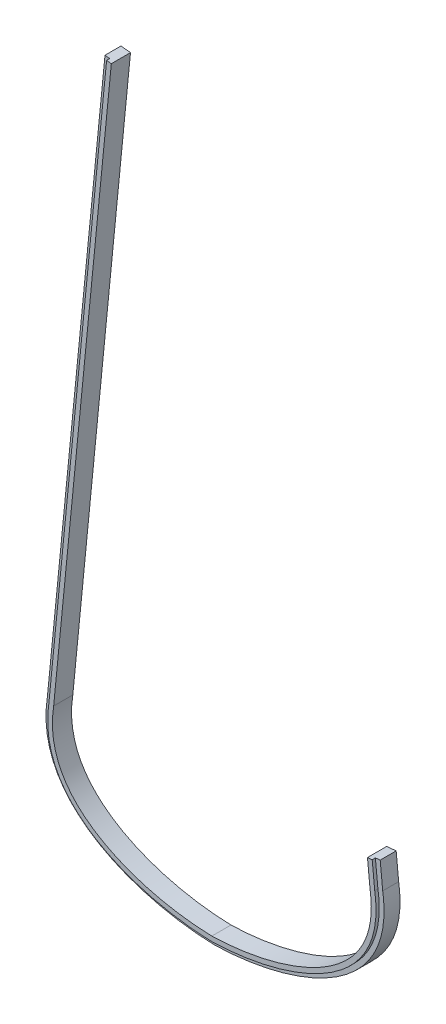
from build123d import *

# Parameters (mm, degrees)
BOSS_EXTRUDE1_DEPTH = 19.05
CUT_EXTRUDE1_START  = -3.175
CUT_EXTRUDE1_DEPTH  = 3.175


# Read off the part's stored shape, not the designer's step: Cut-Extrude1
with BuildPart() as part:
    # Sketch1 → Boss-Extrude1 (new body)
    with BuildSketch(Plane.XY):
        with BuildLine():
            Line((157.234081882, 128.980548454), (154.716315658, 154.51789158))
            Line((154.716315658, 154.51789158), (164.195357535, 155.452445004))
            Line((164.195357535, 155.452445004), (166.6875, 130.175))
            add(Edge.make_bspline(
                [(0, 0), (73.666580622, 1.740675992), (181.188092361, 36.200835609), (166.6875, 130.175)],
                knots=[0, 0, 0, 0, 1, 1, 1, 1], degree=3))
            add(Edge.make_bspline(
                [(0, 0), (-73.666580622, 1.740675992), (-181.188092361, 36.200835609), (-166.6875, 130.175)],
                knots=[0, 0, 0, 0, 1, 1, 1, 1], degree=3))
            Line((-166.6875, 130.175), (-109.368223301, 711.556235093))
            Line((-109.368223301, 711.556235093), (-99.889181424, 710.621681669))
            Line((-99.889181424, 710.621681669), (-157.234081882, 128.980548454))
            add(Edge.make_bspline(
                [(0, 9.52776174), (-1.117611602, 9.555193192), (-3.340472897, 9.624755056), (-7.880039481, 9.827207732), (-13.652210416, 10.198958437), (-20.725459036, 10.840441372), (-30.303235723, 11.962316267), (-42.47749757, 13.875858033), (-57.165232888, 17.02314898), (-71.689613059, 21.050850851), (-90.515854195, 27.626537064), (-112.436111514, 38.157452487), (-130.643933928, 51.803557723), (-142.189146149, 64.564536934), (-149.192253507, 75.075537554), (-153.541361304, 84.674022673), (-156.058613173, 92.923629982), (-157.442658539, 99.418206789), (-158.29640922, 106.242287005), (-158.540175044, 112.221426054), (-158.437150466, 117.190167219), (-158.20642164, 121.010360535), (-157.881730698, 124.277278241), (-157.584058118, 126.601085874), (-157.415798733, 127.781927866), (-157.316566229, 128.446705395), (-157.261207353, 128.804756083), (-157.234081882, 128.980548454)],
                knots=[0.001057036, 0.001057036, 0.001057036, 0.001057036, 0.016679825, 0.032302613, 0.063548191, 0.094793768, 0.126039346, 0.1885305, 0.251021655, 0.31351281, 0.376003965, 0.500986274, 0.625968584, 0.688459739, 0.750950893, 0.813442048, 0.844687626, 0.875933203, 0.90717878, 0.938424358, 0.954047147, 0.969669935, 0.985292724, 0.993104118, 0.997009815, 0.998962664, 1.000915513, 1.000915513, 1.000915513, 1.000915513], degree=3))
            add(Edge.make_bspline(
                [(157.234081882, 128.980548454), (157.261207353, 128.804756083), (157.316566229, 128.446705395), (157.415798733, 127.781927866), (157.584058118, 126.601085874), (157.881730698, 124.277278241), (158.20642164, 121.010360535), (158.437150466, 117.190167219), (158.540175044, 112.221426054), (158.29640922, 106.242287005), (157.442658539, 99.418206789), (156.058613173, 92.923629982), (153.541361304, 84.674022673), (149.192253507, 75.075537554), (142.189146149, 64.564536934), (130.643933928, 51.803557723), (112.436111514, 38.157452487), (90.515854195, 27.626537064), (71.689613059, 21.050850851), (57.165232888, 17.02314898), (42.47749757, 13.875858033), (30.303235723, 11.962316267), (20.725459036, 10.840441372), (13.652210416, 10.198958437), (7.880039481, 9.827207732), (3.340472897, 9.624755056), (1.117611602, 9.555193192), (0, 9.52776174)],
                knots=[0.001057036, 0.001057036, 0.001057036, 0.001057036, 0.003009885, 0.004962733, 0.00886843, 0.016679825, 0.032302613, 0.047925402, 0.063548191, 0.094793768, 0.126039346, 0.157284923, 0.1885305, 0.251021655, 0.31351281, 0.376003965, 0.500986274, 0.625968584, 0.688459739, 0.750950893, 0.813442048, 0.875933203, 0.90717878, 0.938424358, 0.969669935, 0.985292724, 1.000915513, 1.000915513, 1.000915513, 1.000915513], degree=3))
        make_face()
    extrude(amount=BOSS_EXTRUDE1_DEPTH)

    # Cut-Extrude1 outline → Cut-Extrude1 (cut)
    with BuildSketch(Plane.XY.offset(19.05).offset(CUT_EXTRUDE1_START)):
        with BuildLine():
            add(Edge.make_bspline(
                [(0, 4.801965673), (9.039076986, 5.019645615), (18.615343357, 5.740087083), (38.206551494, 8.290420977), (48.221803102, 10.120302171), (68.063126794, 14.983315661), (77.889169822, 18.016665839), (96.726604846, 25.367412999), (105.737388343, 29.685039413), (122.329339782, 39.664160586), (129.908900725, 45.324695844), (139.777007016, 54.855777785), (142.816728459, 58.206110887), (148.333510848, 65.263042796), (150.810694166, 68.969494834), (155.143109198, 76.756286204), (156.998589935, 80.836629029), (160.026646994, 89.399867478), (161.199415591, 93.883005077), (162.79196327, 103.287974059), (163.211691294, 108.210111051), (163.215151327, 115.948212654), (163.111865799, 118.586683423), (162.792061754, 122.635654517), (162.657978395, 124.000517644), (162.414585492, 126.070904339), (162.282321945, 127.11187023), (162.109292482, 128.336489493), (162.031100506, 128.86350908), (161.978072787, 129.215341168), (161.951296998, 129.389464404), (161.922977269, 129.572996421)],
                knots=[0, 0, 0, 0, 0.125, 0.125, 0.25, 0.25, 0.375, 0.375, 0.5, 0.5, 0.625, 0.625, 0.6875, 0.6875, 0.75, 0.75, 0.8125, 0.8125, 0.875, 0.875, 0.9375, 0.9375, 0.96875, 0.96875, 0.984375, 0.984375, 0.9921875, 0.99609375, 0.998046875, 0.998046875, 1, 1, 1, 1], degree=3))
            add(Edge.make_bspline(
                [(-161.922977269, 129.572996421), (-161.951296998, 129.389464404), (-161.978072787, 129.215341168), (-162.031100506, 128.86350908), (-162.109292482, 128.336489493), (-162.282321945, 127.11187023), (-162.590936716, 124.682949208), (-162.792061754, 122.635654517), (-163.111865799, 118.586683423), (-163.215151327, 115.948212654), (-163.211691294, 108.210111051), (-162.79196327, 103.287974059), (-161.199415591, 93.883005077), (-160.026646994, 89.399867478), (-156.998589935, 80.836629029), (-155.143109198, 76.756286204), (-150.810694166, 68.969494834), (-148.333510848, 65.263042796), (-142.816728459, 58.206110887), (-139.777007016, 54.855777785), (-129.908900725, 45.324695844), (-122.329339782, 39.664160586), (-105.737388343, 29.685039413), (-96.726604846, 25.367412999), (-77.889169822, 18.016665839), (-68.063126794, 14.983315661), (-48.221803102, 10.120302171), (-38.206551494, 8.290420977), (-18.615343357, 5.740087083), (-9.039076986, 5.019645615), (0, 4.801965673)],
                knots=[0, 0, 0, 0, 0.001953125, 0.001953125, 0.00390625, 0.0078125, 0.015625, 0.03125, 0.03125, 0.0625, 0.0625, 0.125, 0.125, 0.1875, 0.1875, 0.25, 0.25, 0.3125, 0.3125, 0.375, 0.375, 0.5, 0.5, 0.625, 0.625, 0.75, 0.75, 0.875, 0.875, 1, 1, 1, 1], degree=3))
            Line((-161.922977269, 129.572996421), (-104.590786195, 711.085220167))
            Line((-104.590786195, 711.085220167), (-109.368223301, 711.556235093))
            Line((-109.368223301, 711.556235093), (-166.6875, 130.175))
            add(Edge.make_bspline(
                [(-166.6875, 130.175), (-181.188092361, 36.200835609), (-73.666580622, 1.740675992), (0, 0)],
                knots=[0, 0, 0, 0, 1, 1, 1, 1], degree=3))
            add(Edge.make_bspline(
                [(0, 0), (73.666580622, 1.740675992), (181.188092361, 36.200835609), (166.6875, 130.175)],
                knots=[0, 0, 0, 0, 1, 1, 1, 1], degree=3))
            Line((166.6875, 130.175), (164.195357535, 155.452445004))
            Line((164.195357535, 155.452445004), (159.417920429, 154.981430078))
            Line((159.417920429, 154.981430078), (161.922977269, 129.572996421))
        make_face()
    extrude(amount=CUT_EXTRUDE1_DEPTH, mode=Mode.SUBTRACT)


solid = part.part
